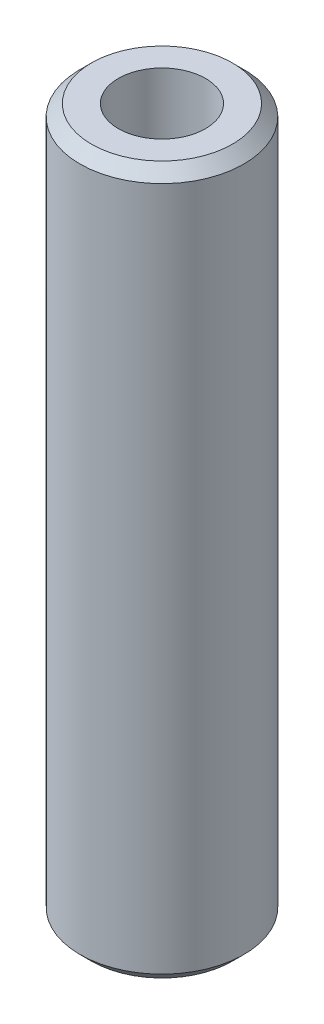
from build123d import *

# Parameters (mm, degrees)
SKETCH1_R           = 15
BOSS_EXTRUDE1_DEPTH = 129.547626299
SKETCH2_R           = 7.980852121
CUT_EXTRUDE1_DEPTH  = 132.272950298
CHAMFER1_SIZE       = 2.097678887


with BuildPart() as part:
    # Sketch1 → Boss-Extrude1 (new body)
    with BuildSketch(Plane(origin=(0, 0, 0), x_dir=(1, 0, 0), z_dir=(0, 1, 0))):
        Circle(SKETCH1_R)
    extrude(amount=BOSS_EXTRUDE1_DEPTH)

    # Sketch2 → Cut-Extrude1 (cut, through all)
    with BuildSketch(Plane(origin=(0, 0, 0), x_dir=(1, 0, 0), z_dir=(0, 1, 0))):
        Circle(SKETCH2_R)
    extrude(amount=CUT_EXTRUDE1_DEPTH, mode=Mode.SUBTRACT)

    # Chamfer1
    chamfer1_edges = [part.edges().sort_by_distance(p)[0] for p in [
        (-15, 129.547626299, 0),
        (-15, 0, 0),
    ]]
    chamfer(chamfer1_edges, length=CHAMFER1_SIZE)


solid = part.part
